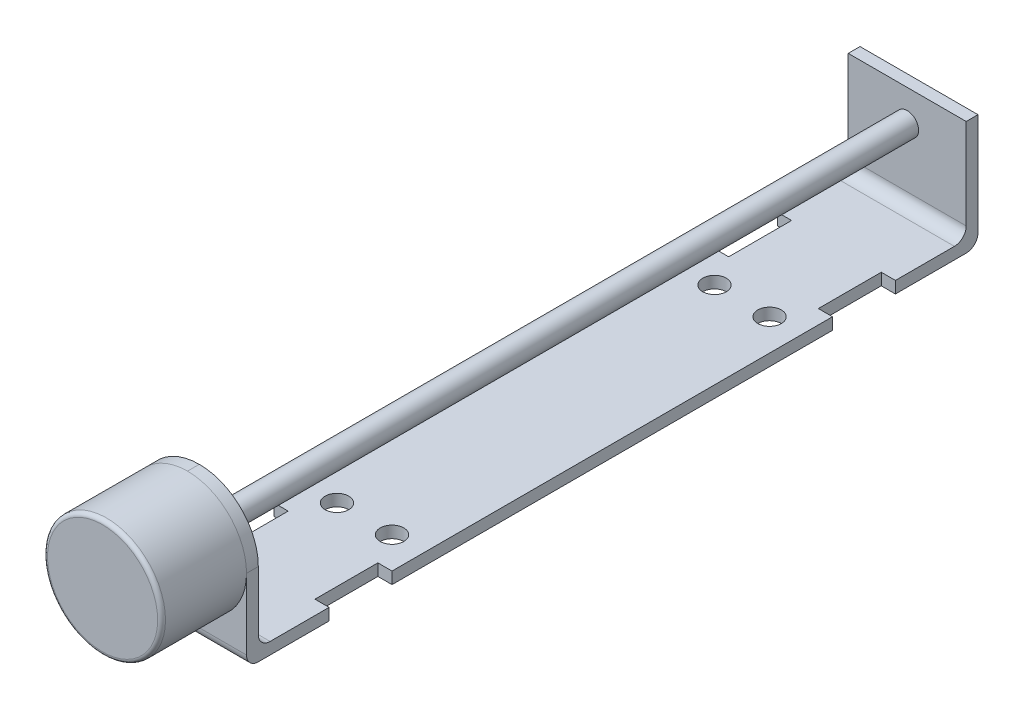
from build123d import *

# Parameters (mm, degrees)
BOSS_EXTRU_1_DEPTH      = 15
CONG_1_R                = 1.5
ESQUISSE2_R             = 7.5
BOSS_EXTRU_2_DEPTH      = 10.8
CONG_2_R                = 7.5
ESQUISSE3_R             = 1.5
ESQUISSE3_W             = 1.8
ESQUISSE3_H             = 8
ENL_V_MAT_EXTRU_1_DEPTH = 62.905492487
ESQUISSE4_R             = 1.45
BOSS_EXTRU_3_DEPTH      = 90
CONG_3_R                = 0.5


with BuildPart() as part:
    # Esquisse1 → Boss.-Extru.1 (new body)
    with BuildSketch(Plane(origin=(0, 0, 0), x_dir=(0, 0, -1), z_dir=(1, 0, 0))):
        Polygon((-46.5, 0), (46.5, 0), (46.5, 14.5), (45, 14.5), (45, 1.5), (-45, 1.5), (-45, 18), (-46.5, 18), align=None)
    extrude(amount=BOSS_EXTRU_1_DEPTH)

    # Congé1
    cong_1_edges = [part.edges().sort_by_distance(p)[0] for p in [
        (7.5, 1.5, 45),
        (7.5, 1.5, -45),
        (7.5, 0, -46.5),
        (7.5, 0, 46.5),
    ]]
    fillet(cong_1_edges, radius=CONG_1_R)

    # Esquisse2 → Boss.-Extru.2 (add)
    with BuildSketch(Plane.XY.offset(46.5)):
        with Locations((7.5, 10.5)):
            Circle(ESQUISSE2_R)
    extrude(amount=BOSS_EXTRU_2_DEPTH)

    # Congé2
    cong_2_edges = [part.edges().sort_by_distance(p)[0] for p in [
        (0, 18, 45.75),
        (15, 18, 45.75),
    ]]
    fillet(cong_2_edges, radius=CONG_2_R - 0.0001)  # a hair under: the kernel refuses the full size

    # Esquisse3 → Enlèv. mat.-Extru.1 (cut, through all)
    with BuildSketch(Plane.XZ):
        with Locations(Location((4, 24, 0), (0, 0, 270))):
            Circle(ESQUISSE3_R)
        with Locations(Location((11, 24, 0), (0, 0, 270))):
            Circle(ESQUISSE3_R)
        with Locations(Location((4, -24, 0), (0, 0, 270))):
            Circle(ESQUISSE3_R)
        with Locations(Location((11, -24, 0), (0, 0, 270))):
            Circle(ESQUISSE3_R)
        with Locations((0.9, 32)):
            Rectangle(ESQUISSE3_W, ESQUISSE3_H)
        with Locations((14.1, 32)):
            Rectangle(ESQUISSE3_W, ESQUISSE3_H)
        with Locations((14.1, -32)):
            Rectangle(ESQUISSE3_W, ESQUISSE3_H)
        with Locations((0.9, -32)):
            Rectangle(ESQUISSE3_W, ESQUISSE3_H)
    extrude(amount=-ENL_V_MAT_EXTRU_1_DEPTH, mode=Mode.SUBTRACT)

    # Esquisse4 → Boss.-Extru.3 (add)
    with BuildSketch(Plane(origin=(0, 0, 45), x_dir=(-1, 0, 0), z_dir=(0, 0, -1))):
        with Locations(Location((-7.5, 10.5, 0), (0, 0, 180))):
            Circle(ESQUISSE4_R)
    extrude(amount=BOSS_EXTRU_3_DEPTH)

    # Congé3
    cong_3_edges = [part.edges().sort_by_distance(p)[0] for p in [
        (0, 10.5, 57.3),
    ]]
    fillet(cong_3_edges, radius=CONG_3_R)


solid = part.part
